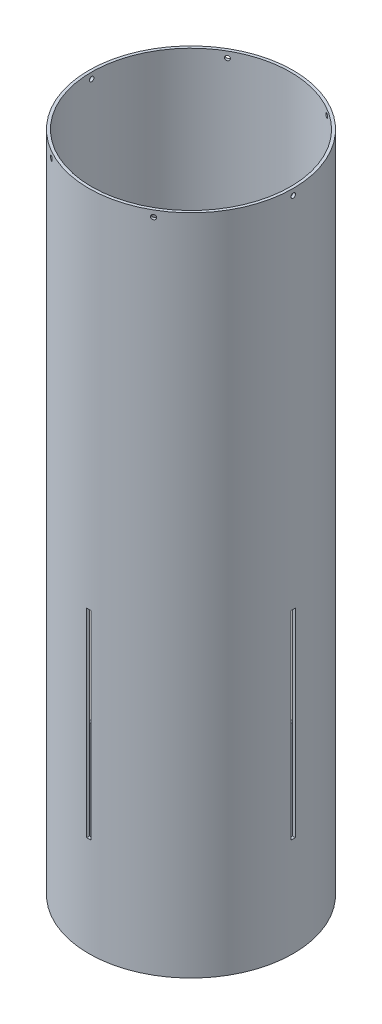
from build123d import *

# Parameters (mm, degrees)
SKETCH1_R           = 78.359
SKETCH1_R_2         = 76.2
BOSS_EXTRUDE1_DEPTH = 508
CUT_EXTRUDE1_DEPTH  = 520.946406625
CIRPATTERN1_COUNT   = 4
CUT_EXTRUDE2_DEPTH  = 520.946406625
CIRPATTERN2_COUNT   = 6


with BuildPart() as part:
    # Sketch1 → Boss-Extrude1 (new body)
    with BuildSketch(Plane(origin=(0, 0, 0), x_dir=(1, 0, 0), z_dir=(0, 1, 0))):
        Circle(SKETCH1_R)
        Circle(SKETCH1_R_2, mode=Mode.SUBTRACT)
    extrude(amount=BOSS_EXTRUDE1_DEPTH)

    # Sketch2 → Cut-Extrude1 (cut, through all)
    with BuildSketch(Plane(origin=(0, 0, 0), x_dir=(0, 0, -1), z_dir=(1, 0, 0))):
        Polygon((0, 76.2), (1.5875, 76.2), (1.5875, 228.6), (-1.5875, 228.6), (-1.5875, 76.2), align=None)
    cut_extrude1 = extrude(amount=-CUT_EXTRUDE1_DEPTH, mode=Mode.SUBTRACT)

    # CirPattern1: Cut-Extrude1 ×4 about axis
    cirpattern1_axis = Axis((0, 0, 0), (0, 1, 0))
    for i in range(1, CIRPATTERN1_COUNT):
        add(cut_extrude1.rotate(cirpattern1_axis, i * 360 / CIRPATTERN1_COUNT), mode=Mode.SUBTRACT)

    # Sketch2<3> → Cut-Extrude2 (cut, through all)
    with BuildSketch(Plane(origin=(0, 0, 0), x_dir=(0, 0, -1), z_dir=(1, 0, 0))):
        with BuildLine():
            ThreePointArc((0, 504.987500056), (-1.237436907, 502.000063093), (1.750000056, 503.2375))
            ThreePointArc((1.750000056, 503.2375), (1.237436907, 504.474936907), (0, 504.987500056))
        make_face()
    cut_extrude2 = extrude(amount=-CUT_EXTRUDE2_DEPTH, mode=Mode.SUBTRACT)

    # CirPattern2: Cut-Extrude2 ×6 about axis
    cirpattern2_axis = Axis((0, 508, 0), (0, -1, 0))
    for i in range(1, CIRPATTERN2_COUNT):
        add(cut_extrude2.rotate(cirpattern2_axis, i * 360 / CIRPATTERN2_COUNT), mode=Mode.SUBTRACT)


solid = part.part
